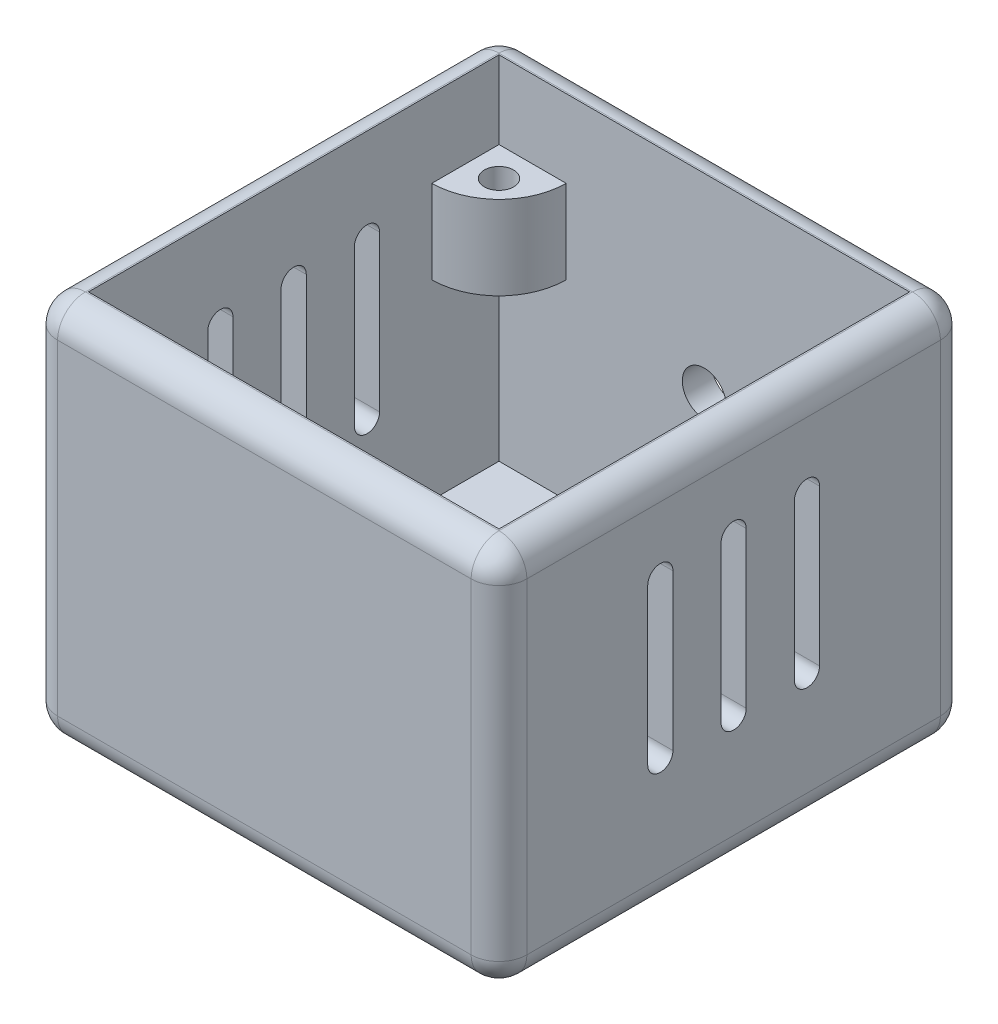
from build123d import *

# Parameters (mm, degrees)
SKETCH_1_W           = 32
SKETCH_1_H           = 32
EXTRUDE_1_DEPTH      = 26
SHELL_1_T            = -2
FILLET_2_R           = 1.9
SKETCH_6_R           = 1
EXTRUDE_3_DEPTH      = 5.7
SKETCH_12_R          = 1.5
CUT_EXTRUDE_5_DEPTH  = 2
SKETCH_13_W          = 3
SKETCH_13_H          = 1.1
CUT_EXTRUDE_7_DEPTH  = 0.8
SKETCH_15_W          = 17.5
SKETCH_15_H          = 1.079565451
CUT_EXTRUDE_8_DEPTH  = 0.5
CUT_EXTRUDE_13_DEPTH = 2
SKETCH_17_W          = 10.9
SKETCH_17_H          = 6.2
SKETCH_17_W_2        = 8.9
SKETCH_17_H_2        = 4.2
EXTRUDE_4_DEPTH      = 2.2
SKETCH_19_W          = 8.9
SKETCH_19_H          = 4.2
CUT_EXTRUDE_11_DEPTH = 2
CUT_EXTRUDE_12_DEPTH = 32


with BuildPart() as part:
    # 草图1 → 凸台-拉伸1 (new body)
    with BuildSketch(Plane(origin=(0, 0, 0), x_dir=(1, 0, 0), z_dir=(0, 1, 0))):
        Rectangle(SKETCH_1_W, SKETCH_1_H)
    extrude(amount=EXTRUDE_1_DEPTH)

    # 抽壳1
    shell_1_openings = [part.faces().sort_by_distance(p)[0] for p in [
        (0, 26, 0),
    ]]
    offset(amount=SHELL_1_T, openings=shell_1_openings, kind=Kind.INTERSECTION)

    # 圆角2
    fillet_2_edges = [part.edges().sort_by_distance(p)[0] for p in [
        (-16, 26, 0),
        (0, 26, -16),
        (-16, 13, -16),
        (0, 0, -16),
        (-16, 0, 0),
        (16, 26, 0),
        (16, 13, -16),
        (16, 0, 0),
        (-16, 13, 16),
        (0, 26, 16),
        (16, 13, 16),
        (0, 0, 16),
    ]]
    fillet(fillet_2_edges, radius=FILLET_2_R)

    # 草图6 → 凸台-拉伸3 (add)
    # profile 1 of 4: a face of its own
    with BuildSketch(Plane(origin=(0, 20.7, 0), x_dir=(1, 0, 0), z_dir=(0, 1, 0))):
        with BuildLine():
            Line((-14, 14), (-9.422209932, 14))
            ThreePointArc((-9.422209932, 14), (-10.7630136, 10.7630136), (-14, 9.422209932))
            Line((-14, 9.422209932), (-14, 14))
        make_face()
        with Locations((-12, 12)):
            Circle(SKETCH_6_R, mode=Mode.SUBTRACT)
    # profile 2 of 4: a face of its own
    with BuildSketch(Plane(origin=(0, 20.7, 0), x_dir=(1, 0, 0), z_dir=(0, 1, 0))):
        with BuildLine():
            Line((14, 14), (14, 9.458479825))
            ThreePointArc((14, 9.458479825), (10.788660287, 10.788660287), (9.458479825, 14))
            Line((9.458479825, 14), (14, 14))
        make_face()
        with Locations((12, 12)):
            Circle(SKETCH_6_R, mode=Mode.SUBTRACT)
    # profile 3 of 4: a face of its own
    with BuildSketch(Plane(origin=(0, 20.7, 0), x_dir=(1, 0, 0), z_dir=(0, 1, 0))):
        with BuildLine():
            Line((-14, -9.417689546), (-14, -14))
            Line((-14, -14), (-9.417689546, -14))
            ThreePointArc((-9.417689546, -14), (-10.759817205, -10.759817205), (-14, -9.417689546))
        make_face()
        with Locations((-12, -12)):
            Circle(SKETCH_6_R, mode=Mode.SUBTRACT)
    # profile 4 of 4: a face of its own
    with BuildSketch(Plane(origin=(0, 20.7, 0), x_dir=(1, 0, 0), z_dir=(0, 1, 0))):
        with BuildLine():
            Line((9.370725518, -14), (14, -14))
            Line((14, -14), (14, -9.370725518))
            ThreePointArc((14, -9.370725518), (10.726608622, -10.726608622), (9.370725518, -14))
        make_face()
        with Locations((12, -12)):
            Circle(SKETCH_6_R, mode=Mode.SUBTRACT)
    extrude(amount=-EXTRUDE_3_DEPTH)

    # 草图12 → 切除-拉伸5 (cut)
    with BuildSketch(Plane(origin=(0, 0, -16), x_dir=(-1, 0, 0), z_dir=(0, 0, -1))):
        with Locations((0, 13)):
            Circle(SKETCH_12_R)
    extrude(amount=-CUT_EXTRUDE_5_DEPTH, mode=Mode.SUBTRACT)

    # 草图13 → 切除-拉伸7 (cut)
    with BuildSketch(Plane.ZY.offset(-14)):
        with Locations((-4, 2.55)):
            Rectangle(SKETCH_13_W, SKETCH_13_H)
        with Locations((10.5, 2.55)):
            Rectangle(SKETCH_13_W, SKETCH_13_H)
    extrude(amount=-CUT_EXTRUDE_7_DEPTH, mode=Mode.SUBTRACT)

    # 草图15 → 切除-拉伸8 (cut)
    with BuildSketch(Plane(origin=(-14, 0, 0), x_dir=(0, 0, -1), z_dir=(1, 0, 0))):
        with Locations((-3.25, 2.539782726)):
            Rectangle(SKETCH_15_W, SKETCH_15_H)
    extrude(amount=-CUT_EXTRUDE_8_DEPTH, mode=Mode.SUBTRACT)

    # 草图16 → 切除-拉伸13 (cut)
    with BuildSketch(Plane.ZY.offset(16)):
        with BuildLine():
            Line((0.05, 6.25), (6.45, 6.25))
            ThreePointArc((6.45, 6.25), (8.2, 4.5), (6.45, 2.75))
            Line((6.45, 2.75), (0.05, 2.75))
            ThreePointArc((0.05, 2.75), (-1.7, 4.5), (0.05, 6.25))
        make_face()
    extrude(amount=-CUT_EXTRUDE_13_DEPTH, mode=Mode.SUBTRACT)

    # 草图17 → 凸台-拉伸4 (add)
    with BuildSketch(Plane(origin=(0, 2, 0), x_dir=(1, 0, 0), z_dir=(0, 1, 0))):
        with Locations((-0.05, 10.9)):
            Rectangle(SKETCH_17_W, SKETCH_17_H)
        with Locations((-0.05, 10.9)):
            Rectangle(SKETCH_17_W_2, SKETCH_17_H_2, mode=Mode.SUBTRACT)
    extrude(amount=EXTRUDE_4_DEPTH)

    # 草图19 → 切除-拉伸11 (cut)
    with BuildSketch(Plane.XZ):
        with Locations((-0.05, -10.9)):
            Rectangle(SKETCH_19_W, SKETCH_19_H)
    extrude(amount=-CUT_EXTRUDE_11_DEPTH, mode=Mode.SUBTRACT)

    # 草图20 → 切除-拉伸12 (cut)
    with BuildSketch(Plane.ZY.offset(16)):
        with BuildLine():
            Line((0.858763674, 19.601706642), (0.858763674, 8.984264858))
            ThreePointArc((0.858763674, 8.984264858), (0, 8.125501184), (-0.858763674, 8.984264858))
            Line((-0.858763674, 8.984264858), (-0.858763674, 19.601706642))
            ThreePointArc((-0.858763674, 19.601706642), (0, 20.460470315), (0.858763674, 19.601706642))
        make_face()
        with BuildLine():
            Line((5.858763674, 19.601706642), (5.858763674, 8.984264858))
            ThreePointArc((5.858763674, 8.984264858), (5, 8.125501184), (4.141236326, 8.984264858))
            Line((4.141236326, 8.984264858), (4.141236326, 19.601706642))
            ThreePointArc((4.141236326, 19.601706642), (5, 20.460470315), (5.858763674, 19.601706642))
        make_face()
        with BuildLine():
            Line((-4.141236326, 19.601706642), (-4.141236326, 8.984264858))
            ThreePointArc((-4.141236326, 8.984264858), (-5, 8.125501184), (-5.858763674, 8.984264858))
            Line((-5.858763674, 8.984264858), (-5.858763674, 19.601706642))
            ThreePointArc((-5.858763674, 19.601706642), (-5, 20.460470315), (-4.141236326, 19.601706642))
        make_face()
    extrude(amount=-CUT_EXTRUDE_12_DEPTH, mode=Mode.SUBTRACT)


solid = part.part
